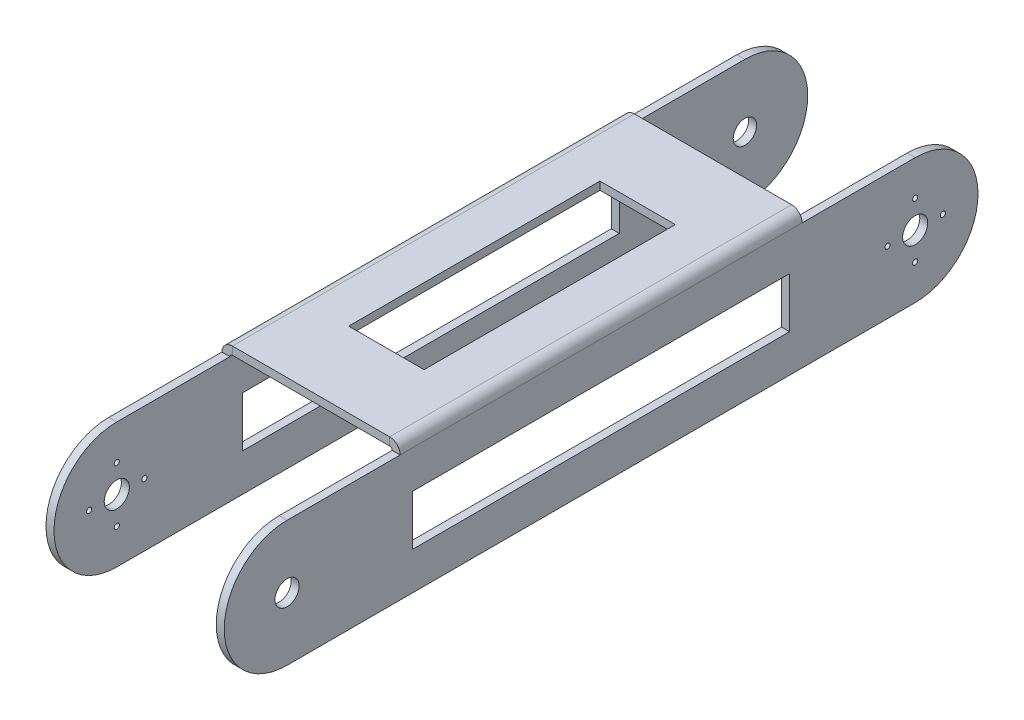
from build123d import *

# Parameters (mm, degrees)
BASE_FLANGE1_DEPTH         = 3.175
SKETCHED_START             = -150
SKETCHED_BEND1_DEPTH       = 300
SKETCHED_BEND1_2_DEPTH     = 70
SKETCHED_START_2           = 80
SKETCHED_BEND1_3_DEPTH     = 70
SKETCHED_BEND1_4_OUTLINE_W = 3.175
SKETCHED_BEND1_4_OUTLINE_H = 50
SKETCHED_BEND1_4_DEPTH     = 300
SKETCHED_START_3           = -80
SKETCHED_BEND1_5_DEPTH     = 160
SKETCH7_R                  = 4.815
CUT_EXTRUDE1_DEPTH         = 10
SKETCH8_R                  = 5
SKETCH8_R_2                = 1.025
CUT_EXTRUDE2_DEPTH         = 10
SKETCH9_R                  = 4.65
SKETCH9_R_2                = 5
SKETCH9_R_3                = 1.025
CUT_EXTRUDE3_DEPTH         = 10
CUT_EXTRUDE4_DEPTH         = 175.553238655
CUT_EXTRUDE5_DEPTH         = 175.553238655
SKETCH13_W                 = 30
SKETCH13_H                 = 100
CUT_EXTRUDE6_DEPTH         = 10
SKETCH14_W                 = 150
SKETCH14_H                 = 20
CUT_EXTRUDE7_DEPTH         = 175.553238655


# Read off the part's stored shape, not the designer's step: Sketched Bend1
# Sheet-metal steps are written as plain solids
with BuildPart() as part:
    # Sketch1 → Base-Flange1 (new body)
    with BuildSketch(Plane(origin=(0, 0, 0), x_dir=(1, 0, 0), z_dir=(0, 1, 0))):
        Polygon((-82.3, 150), (-32.3, 150), (-32.3, 80), (32.3, 80), (32.3, 150), (82.3, 150), (82.3, -150), (32.3, -150), (32.3, -80), (-32.3, -80), (-32.3, -150), (-82.3, -150), align=None)
    extrude(amount=-BASE_FLANGE1_DEPTH)

    # Sketched Bend1 outline → Sketched Bend1 (cut)
    with BuildSketch(Plane.XY.offset(SKETCHED_START)):
        with BuildLine():
            Line((-82.3, -3.175), (-35.353470735, -3.175))
            ThreePointArc((-35.353470735, -3.175), (-33.874453825, -0.888236775), (-31.3, 0))
            Line((-31.3, 0), (-82.3, 0))
            Line((-82.3, 0), (-82.3, -3.175))
        make_face()
        with BuildLine():
            Line((82.3, 0), (31.3, 0))
            ThreePointArc((31.3, 0), (33.874453825, -0.888236775), (35.353470735, -3.175))
            Line((35.353470735, -3.175), (82.3, -3.175))
            Line((82.3, -3.175), (82.3, 0))
        make_face()
    extrude(amount=SKETCHED_BEND1_DEPTH, mode=Mode.SUBTRACT)

    # Sketched Bend1 2 outline → Sketched Bend1 2 (cut)
    with BuildSketch(Plane.XY.offset(SKETCHED_START)):
        with BuildLine():
            Line((-35.353470735, -3.175), (-32.3, -3.175))
            Line((-32.3, -3.175), (-32.3, -0.121529265))
            ThreePointArc((-32.3, -0.121529265), (-34.252170811, -1.222829189), (-35.353470735, -3.175))
        make_face()
        with BuildLine():
            Line((32.3, -0.121529265), (32.3, -3.175))
            Line((32.3, -3.175), (35.353470735, -3.175))
            ThreePointArc((35.353470735, -3.175), (34.252170811, -1.222829189), (32.3, -0.121529265))
        make_face()
    extrude(amount=SKETCHED_BEND1_2_DEPTH, mode=Mode.SUBTRACT)

    # Sketched Bend1 3 outline → Sketched Bend1 3 (cut)
    with BuildSketch(Plane.XY.offset(SKETCHED_START_2)):
        with BuildLine():
            Line((-35.353470735, -3.175), (-32.3, -3.175))
            Line((-32.3, -3.175), (-32.3, -0.121529265))
            ThreePointArc((-32.3, -0.121529265), (-34.252170811, -1.222829189), (-35.353470735, -3.175))
        make_face()
        with BuildLine():
            Line((32.3, -0.121529265), (32.3, -3.175))
            Line((32.3, -3.175), (35.353470735, -3.175))
            ThreePointArc((35.353470735, -3.175), (34.252170811, -1.222829189), (32.3, -0.121529265))
        make_face()
    extrude(amount=SKETCHED_BEND1_3_DEPTH, mode=Mode.SUBTRACT)



with BuildPart() as body_2:
    # Sketched Bend1 4 outline → Sketched Bend1 4 (new body)
    with BuildSketch(Plane.XY.offset(SKETCHED_START)):
        with Locations((-33.8875, -29.175)):
            Rectangle(SKETCHED_BEND1_4_OUTLINE_W, SKETCHED_BEND1_4_OUTLINE_H)
        with Locations((33.8875, -29.175)):
            Rectangle(SKETCHED_BEND1_4_OUTLINE_W, SKETCHED_BEND1_4_OUTLINE_H)
    extrude(amount=SKETCHED_BEND1_4_DEPTH)


with BuildPart() as part_1:
    add(part.part)

    add(body_2.part)  # Sketched Bend1 5 merges body 2
    # Sketched Bend1 5 outline → Sketched Bend1 5 (add)
    with BuildSketch(Plane.XY.offset(SKETCHED_START_3)):
        with BuildLine():
            Line((-35.475, -4.175), (-32.3, -4.175))
            ThreePointArc((-32.3, -4.175), (-32.007106781, -3.467893219), (-31.3, -3.175))
            Line((-31.3, -3.175), (-35.353470735, -3.175))
            ThreePointArc((-35.353470735, -3.175), (-35.444506323, -3.671321193), (-35.475, -4.175))
        make_face()
        with BuildLine():
            Line((35.353470735, -3.175), (31.3, -3.175))
            ThreePointArc((31.3, -3.175), (32.007106781, -3.467893219), (32.3, -4.175))
            Line((32.3, -4.175), (35.475, -4.175))
            ThreePointArc((35.475, -4.175), (35.444506323, -3.671321193), (35.353470735, -3.175))
        make_face()
    extrude(amount=SKETCHED_BEND1_5_DEPTH)

    # Sketch7 → Cut-Extrude1 (cut)
    with BuildSketch(Plane(origin=(35.475, 0, 0), x_dir=(0, 0, -1), z_dir=(1, 0, 0))):
        with Locations(Location((-125, -29.175, 0), (0, 0, 90))):
            Circle(SKETCH7_R)
    extrude(amount=-CUT_EXTRUDE1_DEPTH, mode=Mode.SUBTRACT)

    # Sketch8 → Cut-Extrude2 (cut)
    with BuildSketch(Plane(origin=(35.475, 0, 0), x_dir=(0, 0, -1), z_dir=(1, 0, 0))):
        with Locations(Location((125, -29.175, 0), (0, 0, 90))):
            Circle(SKETCH8_R)
        with Locations(Location((125, -18.175, 0), (0, 0, 90))):
            Circle(SKETCH8_R_2)
        with Locations(Location((125, -40.175, 0), (0, 0, 90))):
            Circle(SKETCH8_R_2)
        with Locations(Location((136, -29.175, 0), (0, 0, 90))):
            Circle(SKETCH8_R_2)
        with Locations(Location((114, -29.175, 0), (0, 0, 90))):
            Circle(SKETCH8_R_2)
    extrude(amount=-CUT_EXTRUDE2_DEPTH, mode=Mode.SUBTRACT)

    # Sketch9 → Cut-Extrude3 (cut)
    with BuildSketch(Plane.ZY.offset(35.475)):
        with Locations(Location((-125, -29.175, 0), (0, 0, 270))):
            Circle(SKETCH9_R)
        with Locations(Location((125, -29.175, 0), (0, 0, 270))):
            Circle(SKETCH9_R_2)
        with Locations(Location((125, -18.175, 0), (0, 0, 270))):
            Circle(SKETCH9_R_3)
        with Locations(Location((114, -29.175, 0), (0, 0, 270))):
            Circle(SKETCH9_R_3)
        with Locations(Location((125, -40.175, 0), (0, 0, 270))):
            Circle(SKETCH9_R_3)
        with Locations(Location((136, -29.175, 0), (0, 0, 270))):
            Circle(SKETCH9_R_3)
    extrude(amount=-CUT_EXTRUDE3_DEPTH, mode=Mode.SUBTRACT)

    # Sketch10 → Cut-Extrude4 (cut, through all)
    with BuildSketch(Plane(origin=(35.475, 0, 0), x_dir=(0, 0, -1), z_dir=(1, 0, 0))):
        with BuildLine():
            ThreePointArc((-150, -29.175), (-142.67766953, -11.49733047), (-125, -4.175))
            Line((-125, -4.175), (-150, -4.175))
            Line((-150, -4.175), (-150, -29.175))
        make_face()
        with BuildLine():
            ThreePointArc((-125, -54.175), (-142.67766953, -46.85266953), (-150, -29.175))
            Line((-150, -29.175), (-150, -54.175))
            Line((-150, -54.175), (-125, -54.175))
        make_face()
    extrude(amount=-CUT_EXTRUDE4_DEPTH, mode=Mode.SUBTRACT)

    # Sketch11 → Cut-Extrude5 (cut, through all)
    with BuildSketch(Plane(origin=(35.475, 0, 0), x_dir=(0, 0, -1), z_dir=(1, 0, 0))):
        with BuildLine():
            Line((150, -4.175), (125, -4.175))
            ThreePointArc((125, -4.175), (142.67766953, -11.49733047), (150, -29.175))
            Line((150, -29.175), (150, -4.175))
        make_face()
        with BuildLine():
            Line((150, -54.175), (150, -29.175))
            ThreePointArc((150, -29.175), (142.67766953, -46.85266953), (125, -54.175))
            Line((125, -54.175), (150, -54.175))
        make_face()
    extrude(amount=-CUT_EXTRUDE5_DEPTH, mode=Mode.SUBTRACT)

    # Sketch13 → Cut-Extrude6 (cut)
    with BuildSketch(Plane(origin=(0, 0, 0), x_dir=(1, 0, 0), z_dir=(0, 1, 0))):
        Rectangle(SKETCH13_W, SKETCH13_H)
    extrude(amount=-CUT_EXTRUDE6_DEPTH, mode=Mode.SUBTRACT)

    # Sketch14 → Cut-Extrude7 (cut, through all)
    with BuildSketch(Plane.ZY.offset(35.475)):
        with Locations((0, -29.175)):
            Rectangle(SKETCH14_W, SKETCH14_H)
    extrude(amount=-CUT_EXTRUDE7_DEPTH, mode=Mode.SUBTRACT)


solid = part_1.part
